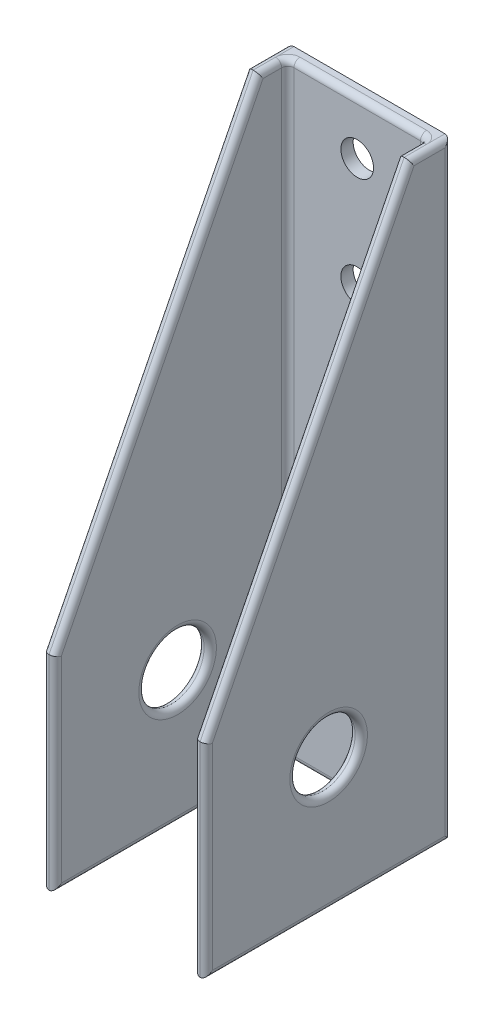
from build123d import *

# Parameters (mm, degrees)
SZKIC1_W                    = 40
SZKIC1_H                    = 149
DODANIE_WYCI_GNI_CIE1_DEPTH = 60
SZKIC2_W                    = 34
SZKIC2_H                    = 57
WYTNIJ_WYCI_GNI_CIE1_DEPTH  = 162.867229543
SZKIC4_R                    = 8
WYTNIJ_WYCI_GNI_CIE2_DEPTH  = 45
SZKIC5_R                    = 4
WYTNIJ_WYCI_GNI_CIE3_DEPTH  = 96.912720741
ZAOKR_GLENIE1_R             = 1.5


with BuildPart() as part:
    # Szkic1 → Dodanie-wyciągnięcie1 (new body)
    with BuildSketch(Plane.XY):
        Rectangle(SZKIC1_W, SZKIC1_H)
    extrude(amount=DODANIE_WYCI_GNI_CIE1_DEPTH)

    # Szkic2 → Wytnij-wyciągnięcie1 (cut, through all)
    with BuildSketch(Plane(origin=(0, 74.5, 0), x_dir=(1, 0, 0), z_dir=(0, 1, 0))):
        with Locations((0, -31.5)):
            Rectangle(SZKIC2_W, SZKIC2_H)
    extrude(amount=-WYTNIJ_WYCI_GNI_CIE1_DEPTH, mode=Mode.SUBTRACT)

    # Szkic4 → Wytnij-wyciągnięcie2 (cut)
    with BuildSketch(Plane.ZY.offset(20)):
        Polygon((10, 74.5), (60, -24.5), (60, 74.5), align=None)
        with Locations((30, -42)):
            Circle(SZKIC4_R)
    extrude(amount=-WYTNIJ_WYCI_GNI_CIE2_DEPTH, mode=Mode.SUBTRACT)

    # Szkic5 → Wytnij-wyciągnięcie3 (cut, through all)
    with BuildSketch(Plane.XY.offset(3)):
        with Locations((0, 61.5)):
            Circle(SZKIC5_R)
        with Locations((0, 34.5)):
            Circle(SZKIC5_R)
        with Locations((0, 7.5)):
            Circle(SZKIC5_R)
    extrude(amount=-WYTNIJ_WYCI_GNI_CIE3_DEPTH, mode=Mode.SUBTRACT)

    # Zaokrąglenie1
    zaokr_glenie1_edges = [part.edges().sort_by_distance(p)[0] for p in [
        (0, 74.5, 3),
        (0, -74.5, 3),
        (20, 74.5, 5),
        (20, 0, 0),
        (20, -74.5, 30),
        (20, -49.5, 60),
        (20, 25, 35),
        (20, -42, 22),
        (17, -49.5, 60),
        (17, -74.5, 31.5),
        (17, 0, 3),
        (17, 74.5, 6.5),
        (17, 25, 35),
        (17, -42, 22),
        (-17, 74.5, 6.5),
        (-17, 0, 3),
        (-17, -74.5, 31.5),
        (-17, -49.5, 60),
        (-17, 25, 35),
        (-17, -42, 22),
        (-20, -49.5, 60),
        (-20, -74.5, 30),
        (-20, 0, 0),
        (-20, 74.5, 5),
        (-20, 25, 35),
        (-20, -42, 22),
    ]]
    fillet(zaokr_glenie1_edges, radius=ZAOKR_GLENIE1_R - 0.0001)  # a hair under: the kernel refuses the full size


solid = part.part
